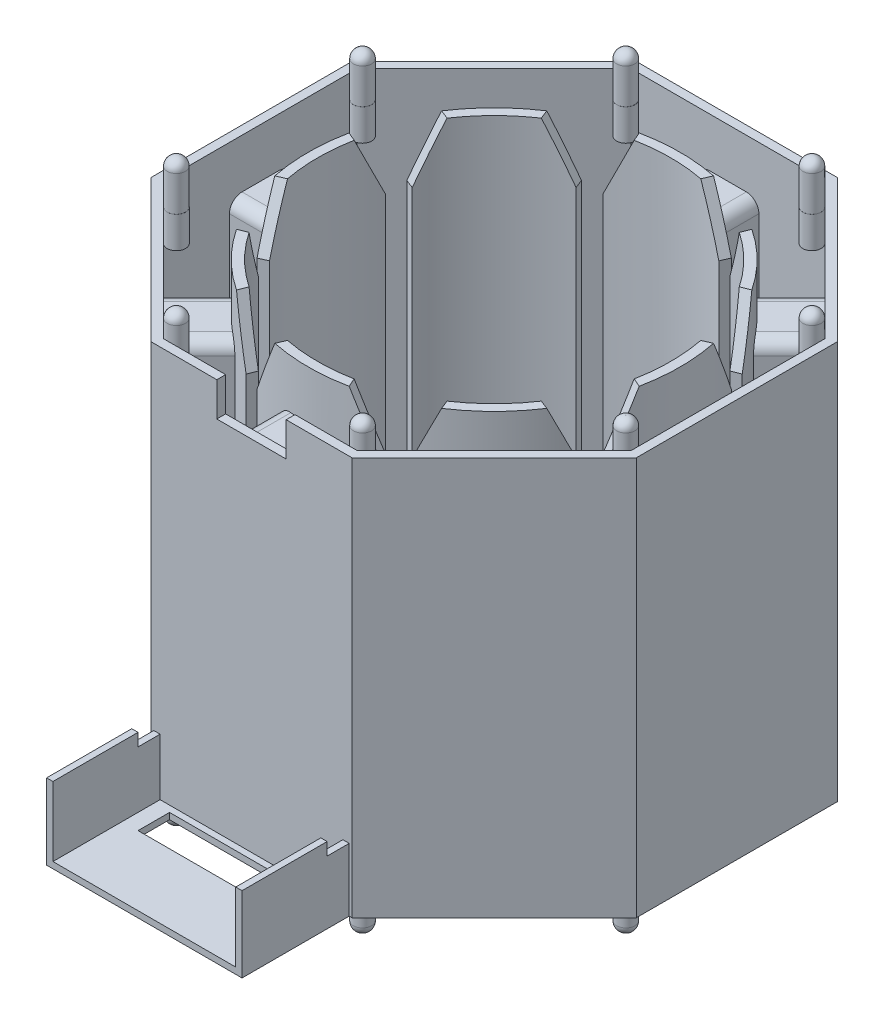
from build123d import *
from OCP.BRepFilletAPI import BRepFilletAPI_MakeChamfer

# Parameters (mm, degrees)
RESSALTO_EXTRUS_O1_DEPTH   = 15.8
RESSALTO_EXTRUS_O2_DEPTH   = 2.5
ESBO_O4_R                  = 0.72
RESSALTO_EXTRUS_O10_DEPTH  = 3.5
FILETE1_R                  = 0.7
RESSALTO_EXTRUS_O11_START  = -2.5
RESSALTO_EXTRUS_O11_DEPTH  = 2.5
RESSALTO_EXTRUS_O12_START  = 3.5
ESBO_O6_R                  = 0.72
RESSALTO_EXTRUS_O12_DEPTH  = 3.5
FILETE2_R                  = 0.7
RESSALTO_EXTRUS_O13_DEPTH  = 8.5
CORTE_EXTRUS_O1_DEPTH      = 47.541406296
CORTE_EXTRUS_O1_DEPTH_BACK = 8.5
ESBO_O8_W                  = 5.5
ESBO_O8_H                  = 2.7
RESSALTO_EXTRUS_O14_DEPTH  = 4.5
ESBO_O10_W                 = 12
ESBO_O10_H                 = 2.5
CORTE_EXTRUS_O2_DEPTH      = 48.569685725
RESSALTO_EXTRUS_O15_DEPTH  = 4.5
RESSALTO_EXTRUS_O16_DEPTH  = 4.5
RESSALTO_EXTRUS_O17_DEPTH  = 4.5
RESSALTO_EXTRUS_O18_START  = 4.5
RESSALTO_EXTRUS_O18_DEPTH  = 4.5
RESSALTO_EXTRUS_O19_START  = 4.5
RESSALTO_EXTRUS_O19_DEPTH  = 4.5
RESSALTO_EXTRUS_O20_START  = 4.5
RESSALTO_EXTRUS_O20_DEPTH  = 4.5
RESSALTO_EXTRUS_O21_DEPTH  = 32.6
CHANFRO1_SIZE              = 4.4
CHANFRO1_SIZE2             = 2
CORTE_EXTRUS_O3_START      = -1
CORTE_EXTRUS_O3_DEPTH      = 1
PADR_OCIRCULAR2_COUNT      = 8
CHANFRO3_SIZE              = 5
CHANFRO3_SIZE2             = 2.9
ESBO_O21_W                 = 12
ESBO_O21_H                 = 0.5
CORTE_EXTRUS_O4_DEPTH      = 0.75
ESBO_O22_W                 = 12
ESBO_O22_H                 = 0.5
RESSALTO_EXTRUS_O22_DEPTH  = 0.75
ESBO_O23_W                 = 0.5
ESBO_O23_H                 = 1.74999997
CORTE_EXTRUS_O5_DEPTH      = 1


with BuildPart() as part:
    # Esboço1 → Ressalto-extrusão1 (new, symmetric)
    with BuildSketch(Plane(origin=(0, 0, 0), x_dir=(1, 0, 0), z_dir=(0, 1, 0))):
        Polygon((19.25, -7.973611076), (19.25, 7.973611076), (7.973611076, 19.25), (-7.973611076, 19.25), (-19.25, 7.973611076), (-19.25, -7.973611076), (-7.973611076, -19.25), (7.973611076, -19.25), align=None)
        Polygon((18.55, -7.683661582), (18.55, 7.683661582), (7.683661582, 18.55), (-7.683661582, 18.55), (-18.55, 7.683661582), (-18.55, -7.683661582), (-7.683661582, -18.55), (7.683661582, -18.55), align=None, mode=Mode.SUBTRACT)
    extrude(amount=RESSALTO_EXTRUS_O1_DEPTH, both=True)

    # Esboço2 → Ressalto-extrusão2 (add)
    with BuildSketch(Plane(origin=(0, 11.7, 0), x_dir=(1, 0, 0), z_dir=(0, 1, 0))):
        with BuildLine():
            Line((-7.683661582, 18.55), (-7.896009166, 18.337652416))
            ThreePointArc((-7.896009166, 18.337652416), (-7.105911261, 17.155187339), (-7.383356749, 18.55))
            Line((-7.383356749, 18.55), (-7.683661582, 18.55))
        make_face()
        with BuildLine():
            Line((7.683661582, 18.55), (7.383356749, 18.55))
            ThreePointArc((7.383356749, 18.55), (7.105911261, 17.155187339), (7.896009166, 18.337652416))
            Line((7.896009166, 18.337652416), (7.683661582, 18.55))
        make_face()
        with BuildLine():
            Line((18.55, 7.683661582), (18.337652416, 7.896009166))
            ThreePointArc((18.337652416, 7.896009166), (17.155187339, 7.105911261), (18.55, 7.383356749))
            Line((18.55, 7.383356749), (18.55, 7.683661582))
        make_face()
        with BuildLine():
            Line((18.55, -7.683661582), (18.55, -7.383356749))
            ThreePointArc((18.55, -7.383356749), (17.155187339, -7.105911261), (18.337652416, -7.896009166))
            Line((18.337652416, -7.896009166), (18.55, -7.683661582))
        make_face()
        with BuildLine():
            Line((7.683661582, -18.55), (7.896009166, -18.337652416))
            ThreePointArc((7.896009166, -18.337652416), (7.105911261, -17.155187339), (7.383356749, -18.55))
            Line((7.383356749, -18.55), (7.683661582, -18.55))
        make_face()
        with BuildLine():
            Line((-7.683661582, -18.55), (-7.383356749, -18.55))
            ThreePointArc((-7.383356749, -18.55), (-7.105911261, -17.155187339), (-7.896009166, -18.337652416))
            Line((-7.896009166, -18.337652416), (-7.683661582, -18.55))
        make_face()
        with BuildLine():
            Line((-18.55, -7.683661582), (-18.337652416, -7.896009166))
            ThreePointArc((-18.337652416, -7.896009166), (-17.155187339, -7.105911261), (-18.55, -7.383356749))
            Line((-18.55, -7.383356749), (-18.55, -7.683661582))
        make_face()
        with BuildLine():
            Line((-18.55, 7.683661582), (-18.55, 7.383356749))
            ThreePointArc((-18.55, 7.383356749), (-17.155187339, 7.105911261), (-18.337652416, 7.896009166))
            Line((-18.337652416, 7.896009166), (-18.55, 7.683661582))
        make_face()
    extrude(amount=RESSALTO_EXTRUS_O2_DEPTH)

    # Esboço4 → Ressalto-extrusão10 (add)
    with BuildSketch(Plane(origin=(0, 14.2, 0), x_dir=(1, 0, 0), z_dir=(0, 1, 0))):
        with Locations((-7.383356749, 17.825)):
            Circle(ESBO_O4_R)
        with Locations((7.383356749, 17.825)):
            Circle(ESBO_O4_R)
        with Locations((17.825, 7.383356749)):
            Circle(ESBO_O4_R)
        with Locations((17.825, -7.383356749)):
            Circle(ESBO_O4_R)
        with Locations((7.383356749, -17.825)):
            Circle(ESBO_O4_R)
        with Locations((-7.383356749, -17.825)):
            Circle(ESBO_O4_R)
        with Locations((-17.825, -7.383356749)):
            Circle(ESBO_O4_R)
        with Locations((-17.825, 7.383356749)):
            Circle(ESBO_O4_R)
    extrude(amount=RESSALTO_EXTRUS_O10_DEPTH)

    # Filete1
    filete1_edges = [part.edges().sort_by_distance(p)[0] for p in [
        (-18.545, 17.7, -7.383356749),
        (-18.545, 17.7, 7.383356749),
        (-8.103356749, 17.7, 17.825),
        (6.663356749, 17.7, 17.825),
        (17.105, 17.7, 7.383356749),
        (17.105, 17.7, -7.383356749),
        (6.663356749, 17.7, -17.825),
        (-8.103356749, 17.7, -17.825),
    ]]
    fillet(filete1_edges, radius=FILETE1_R)

    # Esboço5 → Ressalto-extrusão11 (add)
    with BuildSketch(Plane(origin=(0, -11.7, 0), x_dir=(1, 0, 0), z_dir=(0, 1, 0)).offset(RESSALTO_EXTRUS_O11_START)):
        with BuildLine():
            Line((-18.55, -7.383356749), (-18.55, -7.683661582))
            Line((-18.55, -7.683661582), (-18.337652416, -7.896009166))
            ThreePointArc((-18.337652416, -7.896009166), (-17.155187339, -7.105911261), (-18.55, -7.383356749))
        make_face()
        with BuildLine():
            Line((-7.896009166, -18.337652416), (-7.683661582, -18.55))
            Line((-7.683661582, -18.55), (-7.383356749, -18.55))
            ThreePointArc((-7.383356749, -18.55), (-7.105911261, -17.155187339), (-7.896009166, -18.337652416))
        make_face()
        with BuildLine():
            Line((7.383356749, -18.55), (7.683661582, -18.55))
            Line((7.683661582, -18.55), (7.896009166, -18.337652416))
            ThreePointArc((7.896009166, -18.337652416), (7.105911261, -17.155187339), (7.383356749, -18.55))
        make_face()
        with BuildLine():
            Line((18.337652416, -7.896009166), (18.55, -7.683661582))
            Line((18.55, -7.683661582), (18.55, -7.383356749))
            ThreePointArc((18.55, -7.383356749), (17.155187339, -7.105911261), (18.337652416, -7.896009166))
        make_face()
    extrude(amount=RESSALTO_EXTRUS_O11_DEPTH)

    # Esboço6 → Ressalto-extrusão12 (add)
    with BuildSketch(Plane.XZ.offset(14.2).offset(RESSALTO_EXTRUS_O12_START)):
        with Locations((-17.825, 7.383356749)):
            Circle(ESBO_O6_R)
        with Locations((-7.383356749, 17.825)):
            Circle(ESBO_O6_R)
        with Locations((7.383356749, 17.825)):
            Circle(ESBO_O6_R)
        with Locations((17.825, 7.383356749)):
            Circle(ESBO_O6_R)
    extrude(amount=-RESSALTO_EXTRUS_O12_DEPTH)

    # Filete2
    filete2_edges = [part.edges().sort_by_distance(p)[0] for p in [
        (17.105, -17.7, 7.383356749),
        (6.663356749, -17.7, 17.825),
        (-8.103356749, -17.7, 17.825),
        (-18.545, -17.7, 7.383356749),
    ]]
    fillet(filete2_edges, radius=FILETE2_R)

    # Esboço7 → Ressalto-extrusão13 (add)
    with BuildSketch(Plane.XY.offset(19.25)):
        Polygon((7.75, -15.8), (-7.75, -15.8), (-7.75, -9.8), (-7.25, -9.8), (-7.25, -15.3), (7.25, -15.3), (7.25, -9.8), (7.75, -9.8), align=None)
    extrude(amount=RESSALTO_EXTRUS_O13_DEPTH)

    # Esboço8 → Corte-extrusão1 (cut, two sides: drawn at the far end of the back side and taken through both)
    with BuildSketch(Plane.XY.offset(19.25).offset(-CORTE_EXTRUS_O1_DEPTH_BACK)):
        with Locations((0, 14.45)):
            Rectangle(ESBO_O8_W, ESBO_O8_H)
    extrude(amount=CORTE_EXTRUS_O1_DEPTH + CORTE_EXTRUS_O1_DEPTH_BACK, mode=Mode.SUBTRACT)

    # Esboço9 → Ressalto-extrusão14 (add)
    with BuildSketch(Plane(origin=(-18.55, 0, 0), x_dir=(0, 0, -1), z_dir=(1, 0, 0))):
        with BuildLine():
            Line((-1.45, -11.9), (1.45, -11.9))
            ThreePointArc((1.45, -11.9), (2.157106781, -11.607106781), (2.45, -10.9))
            Line((2.45, -10.9), (2.45, 10.9))
            ThreePointArc((2.45, 10.9), (2.157106781, 11.607106781), (1.45, 11.9))
            Line((1.45, 11.9), (-1.45, 11.9))
            ThreePointArc((-1.45, 11.9), (-2.157106781, 11.607106781), (-2.45, 10.9))
            Line((-2.45, 10.9), (-2.45, -10.9))
            ThreePointArc((-2.45, -10.9), (-2.157106781, -11.607106781), (-1.45, -11.9))
        make_face()
    ressalto_extrus_o14 = extrude(amount=RESSALTO_EXTRUS_O14_DEPTH)

    # Espelhar1: Ressalto-extrusão14 across plane
    add(ressalto_extrus_o14.mirror(Plane(origin=(0, 0, 0), x_dir=(0, 0, 1), z_dir=(1, 0, 0))))

    # Esboço10 → Corte-extrusão2 (cut, through all)
    with BuildSketch(Plane.XZ.offset(15.8)):
        with Locations((0, 21.75)):
            Rectangle(ESBO_O10_W, ESBO_O10_H)
    extrude(amount=-CORTE_EXTRUS_O2_DEPTH, mode=Mode.SUBTRACT)

    # Esboço12 → Ressalto-extrusão15 (add)
    with BuildSketch(Plane(origin=(-13.116830791, 0, 13.116830791), x_dir=(-0.7071067811865477, 0, -0.7071067811865475), z_dir=(0.7071067811865475, 0, -0.7071067811865477))):
        with BuildLine():
            Line((-1.45, -11.9), (1.45, -11.9))
            ThreePointArc((1.45, -11.9), (2.157106781, -11.607106781), (2.45, -10.9))
            Line((2.45, -10.9), (2.45, 10.9))
            ThreePointArc((2.45, 10.9), (2.157106781, 11.607106781), (1.45, 11.9))
            Line((1.45, 11.9), (-1.45, 11.9))
            ThreePointArc((-1.45, 11.9), (-2.157106781, 11.607106781), (-2.45, 10.9))
            Line((-2.45, 10.9), (-2.45, -10.9))
            ThreePointArc((-2.45, -10.9), (-2.157106781, -11.607106781), (-1.45, -11.9))
        make_face()
    extrude(amount=RESSALTO_EXTRUS_O15_DEPTH)

    # Esboço13 → Ressalto-extrusão16 (add)
    with BuildSketch(Plane(origin=(0, 0, 18.55), x_dir=(-1, 0, 0), z_dir=(0, 0, -1))):
        with BuildLine():
            Line((-1.45, -11.9), (1.45, -11.9))
            ThreePointArc((1.45, -11.9), (2.157106781, -11.607106781), (2.45, -10.9))
            Line((2.45, -10.9), (2.45, 10.9))
            ThreePointArc((2.45, 10.9), (2.157106781, 11.607106781), (1.45, 11.9))
            Line((1.45, 11.9), (-1.45, 11.9))
            ThreePointArc((-1.45, 11.9), (-2.157106781, 11.607106781), (-2.45, 10.9))
            Line((-2.45, 10.9), (-2.45, -10.9))
            ThreePointArc((-2.45, -10.9), (-2.157106781, -11.607106781), (-1.45, -11.9))
        make_face()
    extrude(amount=RESSALTO_EXTRUS_O16_DEPTH)

    # Esboço14 → Ressalto-extrusão17 (add)
    with BuildSketch(Plane(origin=(13.116830791, 0, 13.116830791), x_dir=(-0.7071067811865472, 0, 0.7071067811865479), z_dir=(-0.7071067811865479, 0, -0.7071067811865472))):
        with BuildLine():
            Line((-1.45, -11.9), (1.45, -11.9))
            ThreePointArc((1.45, -11.9), (2.157106781, -11.607106781), (2.45, -10.9))
            Line((2.45, -10.9), (2.45, 10.9))
            ThreePointArc((2.45, 10.9), (2.157106781, 11.607106781), (1.45, 11.9))
            Line((1.45, 11.9), (-1.45, 11.9))
            ThreePointArc((-1.45, 11.9), (-2.157106781, 11.607106781), (-2.45, 10.9))
            Line((-2.45, 10.9), (-2.45, -10.9))
            ThreePointArc((-2.45, -10.9), (-2.157106781, -11.607106781), (-1.45, -11.9))
        make_face()
    extrude(amount=RESSALTO_EXTRUS_O17_DEPTH)

    # Esboço15 → Ressalto-extrusão18 (add)
    with BuildSketch(Plane(origin=(13.116830791, 0, -13.116830791), x_dir=(0.7071067811865479, 0, 0.7071067811865471), z_dir=(-0.7071067811865471, 0, 0.7071067811865479)).offset(RESSALTO_EXTRUS_O18_START)):
        with BuildLine():
            Line((-1.45, -11.9), (1.45, -11.9))
            ThreePointArc((1.45, -11.9), (2.157106781, -11.607106781), (2.45, -10.9))
            Line((2.45, -10.9), (2.45, 10.9))
            ThreePointArc((2.45, 10.9), (2.157106781, 11.607106781), (1.45, 11.9))
            Line((1.45, 11.9), (-1.45, 11.9))
            ThreePointArc((-1.45, 11.9), (-2.157106781, 11.607106781), (-2.45, 10.9))
            Line((-2.45, 10.9), (-2.45, -10.9))
            ThreePointArc((-2.45, -10.9), (-2.157106781, -11.607106781), (-1.45, -11.9))
        make_face()
    extrude(amount=-RESSALTO_EXTRUS_O18_DEPTH)

    # Esboço16 → Ressalto-extrusão19 (add)
    with BuildSketch(Plane.XY.offset(-18.55).offset(RESSALTO_EXTRUS_O19_START)):
        with BuildLine():
            Line((-1.45, -11.9), (1.45, -11.9))
            ThreePointArc((1.45, -11.9), (2.157106781, -11.607106781), (2.45, -10.9))
            Line((2.45, -10.9), (2.45, 10.9))
            ThreePointArc((2.45, 10.9), (2.157106781, 11.607106781), (1.45, 11.9))
            Line((1.45, 11.9), (-1.45, 11.9))
            ThreePointArc((-1.45, 11.9), (-2.157106781, 11.607106781), (-2.45, 10.9))
            Line((-2.45, 10.9), (-2.45, -10.9))
            ThreePointArc((-2.45, -10.9), (-2.157106781, -11.607106781), (-1.45, -11.9))
        make_face()
    extrude(amount=-RESSALTO_EXTRUS_O19_DEPTH)

    # Esboço17 → Ressalto-extrusão20 (add)
    with BuildSketch(Plane(origin=(-13.116830791, 0, -13.116830791), x_dir=(0.7071067811865476, 0, -0.7071067811865476), z_dir=(0.7071067811865476, 0, 0.7071067811865476)).offset(RESSALTO_EXTRUS_O20_START)):
        with BuildLine():
            Line((-1.45, -11.9), (1.45, -11.9))
            ThreePointArc((1.45, -11.9), (2.157106781, -11.607106781), (2.45, -10.9))
            Line((2.45, -10.9), (2.45, 10.9))
            ThreePointArc((2.45, 10.9), (2.157106781, 11.607106781), (1.45, 11.9))
            Line((1.45, 11.9), (-1.45, 11.9))
            ThreePointArc((-1.45, 11.9), (-2.157106781, 11.607106781), (-2.45, 10.9))
            Line((-2.45, 10.9), (-2.45, -10.9))
            ThreePointArc((-2.45, -10.9), (-2.157106781, -11.607106781), (-1.45, -11.9))
        make_face()
    extrude(amount=-RESSALTO_EXTRUS_O20_DEPTH)

    # Esboço18 → Ressalto-extrusão21 (add)
    with BuildSketch(Plane(origin=(0, 15.8, 0), x_dir=(1, 0, 0), z_dir=(0, 1, 0))):
        with BuildLine():
            Line((4.595950476, 13.22411582), (4.897168602, 13.9133116))
            ThreePointArc((4.897168602, 13.9133116), (0, 14.75), (-4.897168602, 13.9133116))
            Line((-4.897168602, 13.9133116), (-4.595950476, 13.22411582))
            ThreePointArc((-4.595950476, 13.22411582), (0, 14), (4.595950476, 13.22411582))
        make_face()
        with BuildLine():
            Line((6.101034224, 12.600689719), (6.375375854, 13.301018108))
            ThreePointArc((6.375375854, 13.301018108), (10.429825023, 10.429825023), (13.301018108, 6.375375854))
            Line((13.301018108, 6.375375854), (12.600689719, 6.101034224))
            ThreePointArc((12.600689719, 6.101034224), (9.899494937, 9.899494937), (6.101034224, 12.600689719))
        make_face()
        with BuildLine():
            Line((13.22411582, 4.595950476), (13.9133116, 4.897168602))
            ThreePointArc((13.9133116, 4.897168602), (14.75, 0), (13.9133116, -4.897168602))
            Line((13.9133116, -4.897168602), (13.22411582, -4.595950476))
            ThreePointArc((13.22411582, -4.595950476), (14, 0), (13.22411582, 4.595950476))
        make_face()
        with BuildLine():
            Line((12.600689719, -6.101034224), (13.301018108, -6.375375854))
            ThreePointArc((13.301018108, -6.375375854), (10.429825023, -10.429825022), (6.375375854, -13.301018108))
            Line((6.375375854, -13.301018108), (6.101034224, -12.600689719))
            ThreePointArc((6.101034224, -12.600689719), (9.899494937, -9.899494937), (12.600689719, -6.101034224))
        make_face()
        with BuildLine():
            Line((4.595950476, -13.22411582), (4.897168602, -13.9133116))
            ThreePointArc((4.897168602, -13.9133116), (0, -14.75), (-4.897168602, -13.9133116))
            Line((-4.897168602, -13.9133116), (-4.595950476, -13.22411582))
            ThreePointArc((-4.595950476, -13.22411582), (0, -14), (4.595950476, -13.22411582))
        make_face()
        with BuildLine():
            Line((-6.101034224, -12.600689719), (-6.375375854, -13.301018108))
            ThreePointArc((-6.375375854, -13.301018108), (-10.429825022, -10.429825023), (-13.301018108, -6.375375854))
            Line((-13.301018108, -6.375375854), (-12.600689719, -6.101034224))
            ThreePointArc((-12.600689719, -6.101034224), (-9.899494937, -9.899494937), (-6.101034224, -12.600689719))
        make_face()
        with BuildLine():
            Line((-13.22411582, -4.595950476), (-13.9133116, -4.897168602))
            ThreePointArc((-13.9133116, -4.897168602), (-14.75, 0), (-13.9133116, 4.897168602))
            Line((-13.9133116, 4.897168602), (-13.22411582, 4.595950476))
            ThreePointArc((-13.22411582, 4.595950476), (-14, 0), (-13.22411582, -4.595950476))
        make_face()
        with BuildLine():
            Line((-12.600689719, 6.101034224), (-13.301018108, 6.375375854))
            ThreePointArc((-13.301018108, 6.375375854), (-10.429825023, 10.429825023), (-6.375375854, 13.301018108))
            Line((-6.375375854, 13.301018108), (-6.101034224, 12.600689719))
            ThreePointArc((-6.101034224, 12.600689719), (-9.899494937, 9.899494937), (-12.600689719, 6.101034224))
        make_face()
    extrude(amount=-RESSALTO_EXTRUS_O21_DEPTH)

    # Chanfro1: one chamfer whose edges measure the first distance from different faces: ONE call of the kernel's chamfer builder (chamfer() names one face for all edges)
    chanfro1_edges_1 = [part.edges().sort_by_distance(p)[0] for p in [
        (-6.238205039, 15.8, -12.950853914),
    ]]
    chanfro1_side_1 = [part.faces().sort_by_distance(p)[0] for p in [
        (-6.238205039, -0.5, -12.950853914),
    ]]
    chanfro1_edges_2 = [part.edges().sort_by_distance(p)[0] for p in [
        (-12.950853914, 15.8, -6.238205039),
    ]]
    chanfro1_side_2 = [part.faces().sort_by_distance(p)[0] for p in [
        (-12.950853914, -0.5, -6.238205039),
    ]]
    chanfro1_edges_3 = [part.edges().sort_by_distance(p)[0] for p in [
        (-4.746559539, 15.8, -13.56871371),
    ]]
    chanfro1_side_3 = [part.faces().sort_by_distance(p)[0] for p in [
        (-4.746559539, -0.5, -13.56871371),
    ]]
    chanfro1_edges_4 = [part.edges().sort_by_distance(p)[0] for p in [
        (4.746559539, 15.8, -13.56871371),
    ]]
    chanfro1_side_4 = [part.faces().sort_by_distance(p)[0] for p in [
        (4.746559539, -0.5, -13.56871371),
    ]]
    chanfro1_edges_5 = [part.edges().sort_by_distance(p)[0] for p in [
        (6.238205039, 15.8, -12.950853914),
    ]]
    chanfro1_side_5 = [part.faces().sort_by_distance(p)[0] for p in [
        (6.238205039, -0.5, -12.950853914),
    ]]
    chanfro1_edges_6 = [part.edges().sort_by_distance(p)[0] for p in [
        (12.950853914, 15.8, -6.238205039),
    ]]
    chanfro1_side_6 = [part.faces().sort_by_distance(p)[0] for p in [
        (12.950853914, -0.5, -6.238205039),
    ]]
    chanfro1_edges_7 = [part.edges().sort_by_distance(p)[0] for p in [
        (13.56871371, 15.8, -4.746559539),
    ]]
    chanfro1_side_7 = [part.faces().sort_by_distance(p)[0] for p in [
        (13.56871371, -0.5, -4.746559539),
    ]]
    chanfro1_edges_8 = [part.edges().sort_by_distance(p)[0] for p in [
        (13.56871371, 15.8, 4.746559539),
    ]]
    chanfro1_side_8 = [part.faces().sort_by_distance(p)[0] for p in [
        (13.56871371, -0.5, 4.746559539),
    ]]
    chanfro1_edges_9 = [part.edges().sort_by_distance(p)[0] for p in [
        (12.950853914, 15.8, 6.238205039),
    ]]
    chanfro1_side_9 = [part.faces().sort_by_distance(p)[0] for p in [
        (12.950853914, -0.5, 6.238205039),
    ]]
    chanfro1_edges_10 = [part.edges().sort_by_distance(p)[0] for p in [
        (6.238205039, 15.8, 12.950853914),
    ]]
    chanfro1_side_10 = [part.faces().sort_by_distance(p)[0] for p in [
        (6.238205039, -0.5, 12.950853914),
    ]]
    chanfro1_edges_11 = [part.edges().sort_by_distance(p)[0] for p in [
        (4.746559539, 15.8, 13.56871371),
    ]]
    chanfro1_side_11 = [part.faces().sort_by_distance(p)[0] for p in [
        (4.746559539, -0.5, 13.56871371),
    ]]
    chanfro1_edges_12 = [part.edges().sort_by_distance(p)[0] for p in [
        (-4.746559539, 15.8, 13.56871371),
    ]]
    chanfro1_side_12 = [part.faces().sort_by_distance(p)[0] for p in [
        (-4.746559539, -0.5, 13.56871371),
    ]]
    chanfro1_edges_13 = [part.edges().sort_by_distance(p)[0] for p in [
        (-6.238205039, 15.8, 12.950853914),
    ]]
    chanfro1_side_13 = [part.faces().sort_by_distance(p)[0] for p in [
        (-6.238205039, -0.5, 12.950853914),
    ]]
    chanfro1_edges_14 = [part.edges().sort_by_distance(p)[0] for p in [
        (-12.950853914, 15.8, 6.238205039),
    ]]
    chanfro1_side_14 = [part.faces().sort_by_distance(p)[0] for p in [
        (-12.950853914, -0.5, 6.238205039),
    ]]
    chanfro1_edges_15 = [part.edges().sort_by_distance(p)[0] for p in [
        (-13.56871371, 15.8, 4.746559539),
    ]]
    chanfro1_side_15 = [part.faces().sort_by_distance(p)[0] for p in [
        (-13.56871371, -0.5, 4.746559539),
    ]]
    chanfro1_edges_16 = [part.edges().sort_by_distance(p)[0] for p in [
        (-13.56871371, 15.8, -4.746559539),
    ]]
    chanfro1_side_16 = [part.faces().sort_by_distance(p)[0] for p in [
        (-13.56871371, -0.5, -4.746559539),
    ]]
    chanfro1 = BRepFilletAPI_MakeChamfer(part.part.solid().wrapped)
    for e in chanfro1_edges_1:
        chanfro1.Add(CHANFRO1_SIZE, CHANFRO1_SIZE2, e.wrapped, chanfro1_side_1[0].wrapped)  # the first distance lies on this face
    for e in chanfro1_edges_2:
        chanfro1.Add(CHANFRO1_SIZE, CHANFRO1_SIZE2, e.wrapped, chanfro1_side_2[0].wrapped)  # the first distance lies on this face
    for e in chanfro1_edges_3:
        chanfro1.Add(CHANFRO1_SIZE, CHANFRO1_SIZE2, e.wrapped, chanfro1_side_3[0].wrapped)  # the first distance lies on this face
    for e in chanfro1_edges_4:
        chanfro1.Add(CHANFRO1_SIZE, CHANFRO1_SIZE2, e.wrapped, chanfro1_side_4[0].wrapped)  # the first distance lies on this face
    for e in chanfro1_edges_5:
        chanfro1.Add(CHANFRO1_SIZE, CHANFRO1_SIZE2, e.wrapped, chanfro1_side_5[0].wrapped)  # the first distance lies on this face
    for e in chanfro1_edges_6:
        chanfro1.Add(CHANFRO1_SIZE, CHANFRO1_SIZE2, e.wrapped, chanfro1_side_6[0].wrapped)  # the first distance lies on this face
    for e in chanfro1_edges_7:
        chanfro1.Add(CHANFRO1_SIZE, CHANFRO1_SIZE2, e.wrapped, chanfro1_side_7[0].wrapped)  # the first distance lies on this face
    for e in chanfro1_edges_8:
        chanfro1.Add(CHANFRO1_SIZE, CHANFRO1_SIZE2, e.wrapped, chanfro1_side_8[0].wrapped)  # the first distance lies on this face
    for e in chanfro1_edges_9:
        chanfro1.Add(CHANFRO1_SIZE, CHANFRO1_SIZE2, e.wrapped, chanfro1_side_9[0].wrapped)  # the first distance lies on this face
    for e in chanfro1_edges_10:
        chanfro1.Add(CHANFRO1_SIZE, CHANFRO1_SIZE2, e.wrapped, chanfro1_side_10[0].wrapped)  # the first distance lies on this face
    for e in chanfro1_edges_11:
        chanfro1.Add(CHANFRO1_SIZE, CHANFRO1_SIZE2, e.wrapped, chanfro1_side_11[0].wrapped)  # the first distance lies on this face
    for e in chanfro1_edges_12:
        chanfro1.Add(CHANFRO1_SIZE, CHANFRO1_SIZE2, e.wrapped, chanfro1_side_12[0].wrapped)  # the first distance lies on this face
    for e in chanfro1_edges_13:
        chanfro1.Add(CHANFRO1_SIZE, CHANFRO1_SIZE2, e.wrapped, chanfro1_side_13[0].wrapped)  # the first distance lies on this face
    for e in chanfro1_edges_14:
        chanfro1.Add(CHANFRO1_SIZE, CHANFRO1_SIZE2, e.wrapped, chanfro1_side_14[0].wrapped)  # the first distance lies on this face
    for e in chanfro1_edges_15:
        chanfro1.Add(CHANFRO1_SIZE, CHANFRO1_SIZE2, e.wrapped, chanfro1_side_15[0].wrapped)  # the first distance lies on this face
    for e in chanfro1_edges_16:
        chanfro1.Add(CHANFRO1_SIZE, CHANFRO1_SIZE2, e.wrapped, chanfro1_side_16[0].wrapped)  # the first distance lies on this face
    add(Compound.cast(chanfro1.Shape()), mode=Mode.REPLACE)

    # Esboço19 → Corte-extrusão3 (cut)
    with BuildSketch(Plane.XZ.offset(16.8).offset(CORTE_EXTRUS_O3_START)):
        with BuildLine():
            Line((1.094545455, 13.95714764), (1.075, 14.710774113))
            ThreePointArc((1.075, 14.710774113), (3.012587935, 14.439072475), (4.897168602, 13.9133116))
            Line((4.897168602, 13.9133116), (4.595950476, 13.22411582))
            ThreePointArc((4.595950476, 13.22411582), (2.868757553, 13.702927793), (1.094545455, 13.95714764))
        make_face()
        with BuildLine():
            Line((-4.897168602, 13.9133116), (-4.595950476, 13.22411582))
            ThreePointArc((-4.595950476, 13.22411582), (-2.868757553, 13.702927793), (-1.094545455, 13.95714764))
            Line((-1.094545455, 13.95714764), (-1.075, 14.710774113))
            ThreePointArc((-1.075, 14.710774113), (-3.012587935, 14.439072475), (-4.897168602, 13.9133116))
        make_face()
    corte_extrus_o3 = extrude(amount=CORTE_EXTRUS_O3_DEPTH, mode=Mode.SUBTRACT)

    # PadrãoCircular2: Corte-extrusão3 ×8 about axis
    padr_ocircular2_axis = Axis((0, -16.8, 0), (0, -1, 0))
    for i in range(1, PADR_OCIRCULAR2_COUNT):
        add(corte_extrus_o3.rotate(padr_ocircular2_axis, i * 360 / PADR_OCIRCULAR2_COUNT), mode=Mode.SUBTRACT)

    # Chanfro3: one chamfer whose edges measure the first distance from different faces: ONE call of the kernel's chamfer builder (chamfer() names one face for all edges)
    chanfro3_edges_1 = [part.edges().sort_by_distance(p)[0] for p in [
        (-6.238205039, -15.8, 12.950853914),
    ]]
    chanfro3_side_1 = [part.faces().sort_by_distance(p)[0] for p in [
        (-6.238205039, -2.2, 12.950853914),
    ]]
    chanfro3_edges_2 = [part.edges().sort_by_distance(p)[0] for p in [
        (-12.950853914, -15.8, 6.238205039),
    ]]
    chanfro3_side_2 = [part.faces().sort_by_distance(p)[0] for p in [
        (-12.950853914, -2.2, 6.238205039),
    ]]
    chanfro3_edges_3 = [part.edges().sort_by_distance(p)[0] for p in [
        (-13.56871371, -15.8, 4.746559539),
    ]]
    chanfro3_side_3 = [part.faces().sort_by_distance(p)[0] for p in [
        (-13.56871371, -2.2, 4.746559539),
    ]]
    chanfro3_edges_4 = [part.edges().sort_by_distance(p)[0] for p in [
        (-13.56871371, -15.8, -4.746559539),
    ]]
    chanfro3_side_4 = [part.faces().sort_by_distance(p)[0] for p in [
        (-13.56871371, -2.2, -4.746559539),
    ]]
    chanfro3_edges_5 = [part.edges().sort_by_distance(p)[0] for p in [
        (-12.950853914, -15.8, -6.238205039),
    ]]
    chanfro3_side_5 = [part.faces().sort_by_distance(p)[0] for p in [
        (-12.950853914, -2.2, -6.238205039),
    ]]
    chanfro3_edges_6 = [part.edges().sort_by_distance(p)[0] for p in [
        (-6.238205039, -15.8, -12.950853914),
    ]]
    chanfro3_side_6 = [part.faces().sort_by_distance(p)[0] for p in [
        (-6.238205039, -2.2, -12.950853914),
    ]]
    chanfro3_edges_7 = [part.edges().sort_by_distance(p)[0] for p in [
        (-4.746559539, -15.8, -13.56871371),
    ]]
    chanfro3_side_7 = [part.faces().sort_by_distance(p)[0] for p in [
        (-4.746559539, -2.2, -13.56871371),
    ]]
    chanfro3_edges_8 = [part.edges().sort_by_distance(p)[0] for p in [
        (4.746559539, -15.8, -13.56871371),
    ]]
    chanfro3_side_8 = [part.faces().sort_by_distance(p)[0] for p in [
        (4.746559539, -2.2, -13.56871371),
    ]]
    chanfro3_edges_9 = [part.edges().sort_by_distance(p)[0] for p in [
        (6.238205039, -15.8, -12.950853914),
    ]]
    chanfro3_side_9 = [part.faces().sort_by_distance(p)[0] for p in [
        (6.238205039, -2.2, -12.950853914),
    ]]
    chanfro3_edges_10 = [part.edges().sort_by_distance(p)[0] for p in [
        (12.950853914, -15.8, -6.238205039),
    ]]
    chanfro3_side_10 = [part.faces().sort_by_distance(p)[0] for p in [
        (12.950853914, -2.2, -6.238205039),
    ]]
    chanfro3_edges_11 = [part.edges().sort_by_distance(p)[0] for p in [
        (13.56871371, -15.8, -4.746559539),
    ]]
    chanfro3_side_11 = [part.faces().sort_by_distance(p)[0] for p in [
        (13.56871371, -2.2, -4.746559539),
    ]]
    chanfro3_edges_12 = [part.edges().sort_by_distance(p)[0] for p in [
        (13.56871371, -15.8, 4.746559539),
    ]]
    chanfro3_side_12 = [part.faces().sort_by_distance(p)[0] for p in [
        (13.56871371, -2.2, 4.746559539),
    ]]
    chanfro3_edges_13 = [part.edges().sort_by_distance(p)[0] for p in [
        (12.950853914, -15.8, 6.238205039),
    ]]
    chanfro3_side_13 = [part.faces().sort_by_distance(p)[0] for p in [
        (12.950853914, -2.2, 6.238205039),
    ]]
    chanfro3_edges_14 = [part.edges().sort_by_distance(p)[0] for p in [
        (6.238205039, -15.8, 12.950853914),
    ]]
    chanfro3_side_14 = [part.faces().sort_by_distance(p)[0] for p in [
        (6.238205039, -2.2, 12.950853914),
    ]]
    chanfro3_edges_15 = [part.edges().sort_by_distance(p)[0] for p in [
        (-4.746559539, -15.8, 13.56871371),
    ]]
    chanfro3_side_15 = [part.faces().sort_by_distance(p)[0] for p in [
        (-4.746559539, -2.2, 13.56871371),
    ]]
    chanfro3_edges_16 = [part.edges().sort_by_distance(p)[0] for p in [
        (4.746559539, -15.8, 13.56871371),
    ]]
    chanfro3_side_16 = [part.faces().sort_by_distance(p)[0] for p in [
        (4.746559539, -2.2, 13.56871371),
    ]]
    chanfro3 = BRepFilletAPI_MakeChamfer(part.part.solid().wrapped)
    for e in chanfro3_edges_1:
        chanfro3.Add(CHANFRO3_SIZE, CHANFRO3_SIZE2, e.wrapped, chanfro3_side_1[0].wrapped)  # the first distance lies on this face
    for e in chanfro3_edges_2:
        chanfro3.Add(CHANFRO3_SIZE, CHANFRO3_SIZE2, e.wrapped, chanfro3_side_2[0].wrapped)  # the first distance lies on this face
    for e in chanfro3_edges_3:
        chanfro3.Add(CHANFRO3_SIZE, CHANFRO3_SIZE2, e.wrapped, chanfro3_side_3[0].wrapped)  # the first distance lies on this face
    for e in chanfro3_edges_4:
        chanfro3.Add(CHANFRO3_SIZE, CHANFRO3_SIZE2, e.wrapped, chanfro3_side_4[0].wrapped)  # the first distance lies on this face
    for e in chanfro3_edges_5:
        chanfro3.Add(CHANFRO3_SIZE, CHANFRO3_SIZE2, e.wrapped, chanfro3_side_5[0].wrapped)  # the first distance lies on this face
    for e in chanfro3_edges_6:
        chanfro3.Add(CHANFRO3_SIZE, CHANFRO3_SIZE2, e.wrapped, chanfro3_side_6[0].wrapped)  # the first distance lies on this face
    for e in chanfro3_edges_7:
        chanfro3.Add(CHANFRO3_SIZE, CHANFRO3_SIZE2, e.wrapped, chanfro3_side_7[0].wrapped)  # the first distance lies on this face
    for e in chanfro3_edges_8:
        chanfro3.Add(CHANFRO3_SIZE, CHANFRO3_SIZE2, e.wrapped, chanfro3_side_8[0].wrapped)  # the first distance lies on this face
    for e in chanfro3_edges_9:
        chanfro3.Add(CHANFRO3_SIZE, CHANFRO3_SIZE2, e.wrapped, chanfro3_side_9[0].wrapped)  # the first distance lies on this face
    for e in chanfro3_edges_10:
        chanfro3.Add(CHANFRO3_SIZE, CHANFRO3_SIZE2, e.wrapped, chanfro3_side_10[0].wrapped)  # the first distance lies on this face
    for e in chanfro3_edges_11:
        chanfro3.Add(CHANFRO3_SIZE, CHANFRO3_SIZE2, e.wrapped, chanfro3_side_11[0].wrapped)  # the first distance lies on this face
    for e in chanfro3_edges_12:
        chanfro3.Add(CHANFRO3_SIZE, CHANFRO3_SIZE2, e.wrapped, chanfro3_side_12[0].wrapped)  # the first distance lies on this face
    for e in chanfro3_edges_13:
        chanfro3.Add(CHANFRO3_SIZE, CHANFRO3_SIZE2, e.wrapped, chanfro3_side_13[0].wrapped)  # the first distance lies on this face
    for e in chanfro3_edges_14:
        chanfro3.Add(CHANFRO3_SIZE, CHANFRO3_SIZE2, e.wrapped, chanfro3_side_14[0].wrapped)  # the first distance lies on this face
    for e in chanfro3_edges_15:
        chanfro3.Add(CHANFRO3_SIZE, CHANFRO3_SIZE2, e.wrapped, chanfro3_side_15[0].wrapped)  # the first distance lies on this face
    for e in chanfro3_edges_16:
        chanfro3.Add(CHANFRO3_SIZE, CHANFRO3_SIZE2, e.wrapped, chanfro3_side_16[0].wrapped)  # the first distance lies on this face
    add(Compound.cast(chanfro3.Shape()), mode=Mode.REPLACE)

    # Esboço21 → Corte-extrusão4 (cut)
    with BuildSketch(Plane.XY.offset(20.5)):
        with Locations((0, -15.55)):
            Rectangle(ESBO_O21_W, ESBO_O21_H)
    extrude(amount=-CORTE_EXTRUS_O4_DEPTH, mode=Mode.SUBTRACT)

    # Esboço22 → Ressalto-extrusão22 (add)
    with BuildSketch(Plane(origin=(0, 0, 23), x_dir=(-1, 0, 0), z_dir=(0, 0, -1))):
        with Locations((0, -15.55)):
            Rectangle(ESBO_O22_W, ESBO_O22_H)
    extrude(amount=RESSALTO_EXTRUS_O22_DEPTH)

    # Esboço23 → Corte-extrusão5 (cut)
    with BuildSketch(Plane(origin=(0, -9.8, 0), x_dir=(1, 0, 0), z_dir=(0, 1, 0))):
        with Locations((-7.5, -20.124999985)):
            Rectangle(ESBO_O23_W, ESBO_O23_H)
        with Locations((7.5, -20.124999985)):
            Rectangle(ESBO_O23_W, ESBO_O23_H)
    extrude(amount=-CORTE_EXTRUS_O5_DEPTH, mode=Mode.SUBTRACT)


solid = part.part
